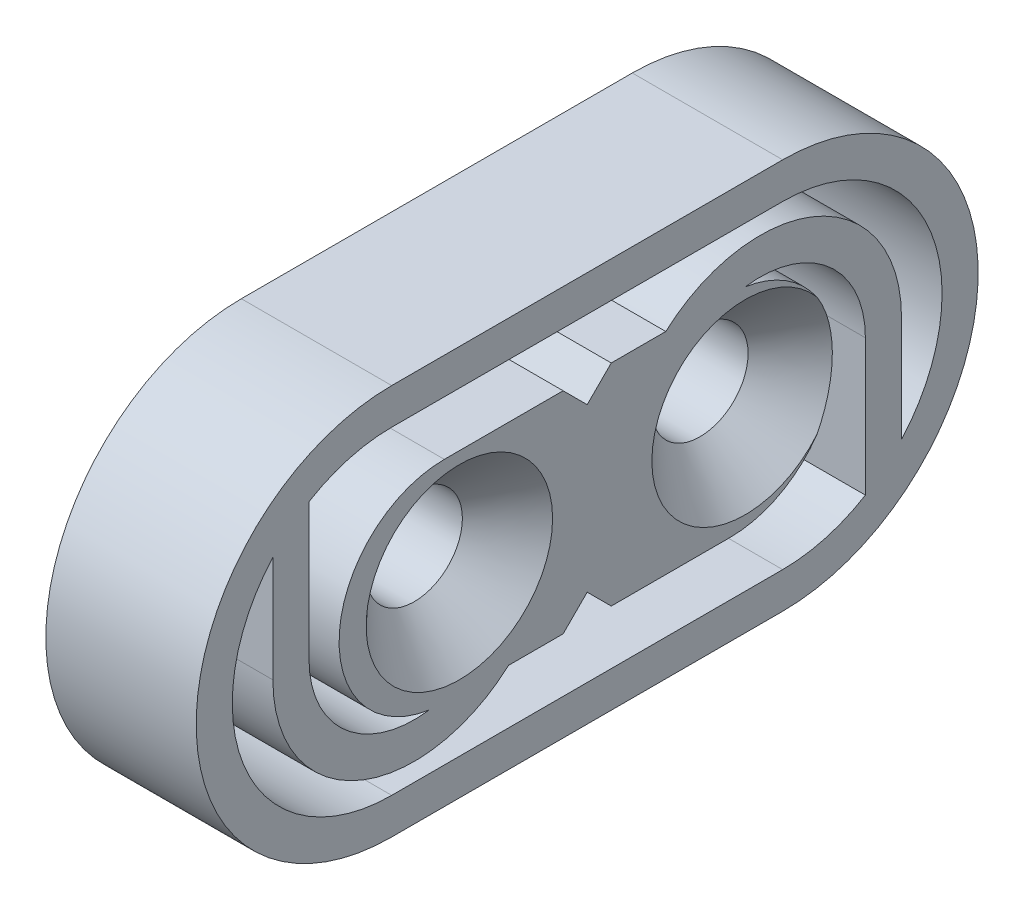
from build123d import *

# Parameters (mm, degrees)
BOSS_EXTRUDE2_DEPTH = 5
SKETCH4_R           = 1.6
CUT_EXTRUDE1_DEPTH  = 10
CHAMFER1_SIZE       = 1.5


with BuildPart() as part:
    # Sketch2 → Boss-Extrude2 (new body)
    with BuildSketch(Plane.YZ):
        with BuildLine():
            Line((-6.472145094, 6.496243265), (-6.472145094, -6.503756735))
            ThreePointArc((-6.472145094, -6.503756735), (0.027854906, -13.003756735), (6.527854906, -6.503756735))
            Line((6.527854906, -6.503756735), (6.527854906, 6.496243265))
            ThreePointArc((6.527854906, 6.496243265), (0.027854906, 12.996243265), (-6.472145094, 6.496243265))
        make_face()
        with BuildLine():
            Line((-5.272145094, 6.496243265), (-5.272145094, -6.503756735))
            ThreePointArc((-5.272145094, -6.503756735), (-5.076205272, -7.931541625), (-4.502873512, -9.253756735))
            Line((-4.502873512, -9.253756735), (0.027854906, -9.253756735))
            ThreePointArc((0.027854906, -9.253756735), (2.673606218, -8.045044583), (3.491956522, -5.253756735))
            ThreePointArc((3.491956522, -5.253756735), (-0.222788612, -8.244770603), (-3.472145094, -4.753756735))
            Line((-3.472145094, -4.753756735), (-3.472145094, -0.803756735))
            Line((-3.472145094, -0.803756735), (-2.672145094, -0.003756735))
            Line((-2.672145094, -0.003756735), (-3.472145094, 0.796243265))
            Line((-3.472145094, 0.796243265), (-3.472145094, 2.609365837))
            ThreePointArc((-3.472145094, 2.609365837), (-4.263608941, 7.662838695), (0.027854906, 10.446243265))
            Line((0.027854906, 10.446243265), (3.561620603, 10.446243265))
            ThreePointArc((3.561620603, 10.446243265), (-2.135596249, 11.334577596), (-5.272145094, 6.496243265))
        make_face(mode=Mode.SUBTRACT)
        with BuildLine():
            Line((4.558583325, 9.246243265), (0.027854906, 9.246243265))
            ThreePointArc((0.027854906, 9.246243265), (-2.617896405, 8.037531112), (-3.436246709, 5.246243265))
            ThreePointArc((-3.436246709, 5.246243265), (0.278498425, 8.237257133), (3.527854906, 4.746243265))
            Line((3.527854906, 4.746243265), (3.527854906, 0.796243265))
            Line((3.527854906, 0.796243265), (2.727854906, -0.003756735))
            Line((2.727854906, -0.003756735), (3.527854906, -0.803756735))
            Line((3.527854906, -0.803756735), (3.527854906, -2.616879307))
            ThreePointArc((3.527854906, -2.616879307), (4.319318754, -7.670352166), (0.027854906, -10.453756735))
            Line((0.027854906, -10.453756735), (-3.50591079, -10.453756735))
            ThreePointArc((-3.50591079, -10.453756735), (2.191306062, -11.342091066), (5.327854906, -6.503756735))
            Line((5.327854906, -6.503756735), (5.327854906, 6.496243265))
            ThreePointArc((5.327854906, 6.496243265), (5.131915085, 7.924028155), (4.558583325, 9.246243265))
        make_face(mode=Mode.SUBTRACT)
    extrude(amount=BOSS_EXTRUDE2_DEPTH)

    # Sketch4 → Cut-Extrude1 (cut)
    with BuildSketch(Plane.YZ.offset(5)):
        with Locations(Location((0.027854906, 4.246243265, 0), (0, 0, 270))):
            Circle(SKETCH4_R)
        with Locations(Location((0.027854906, -5.253756735, 0), (0, 0, 270))):
            Circle(SKETCH4_R)
    extrude(amount=-CUT_EXTRUDE1_DEPTH, mode=Mode.SUBTRACT)

    # Chamfer1
    # the kernel refuses this chamfer: 1.5 mm, written as the material it takes off along each edge
    with BuildSketch(Plane(origin=(5, 0.027854906, 4.246243265), x_dir=(0, 0, -1), z_dir=(0, -1, 0))) as chamfer1_piece_1:
        Polygon((1.6 + CHAMFER1_SIZE, 0), (1.6, -CHAMFER1_SIZE), (1.6, 0), align=None)
    revolve(axis=Axis((5, 0.027854906, 4.246243265), (1, 0, 0)), mode=Mode.SUBTRACT)
    with BuildSketch(Plane(origin=(5, 0.027854906, -5.253756735), x_dir=(0, 0, -1), z_dir=(0, -1, 0))) as chamfer1_piece_2:
        Polygon((1.6 + CHAMFER1_SIZE, 0), (1.6, -CHAMFER1_SIZE), (1.6, 0), align=None)
    revolve(axis=Axis((5, 0.027854906, -5.253756735), (1, 0, 0)), mode=Mode.SUBTRACT)


solid = part.part
